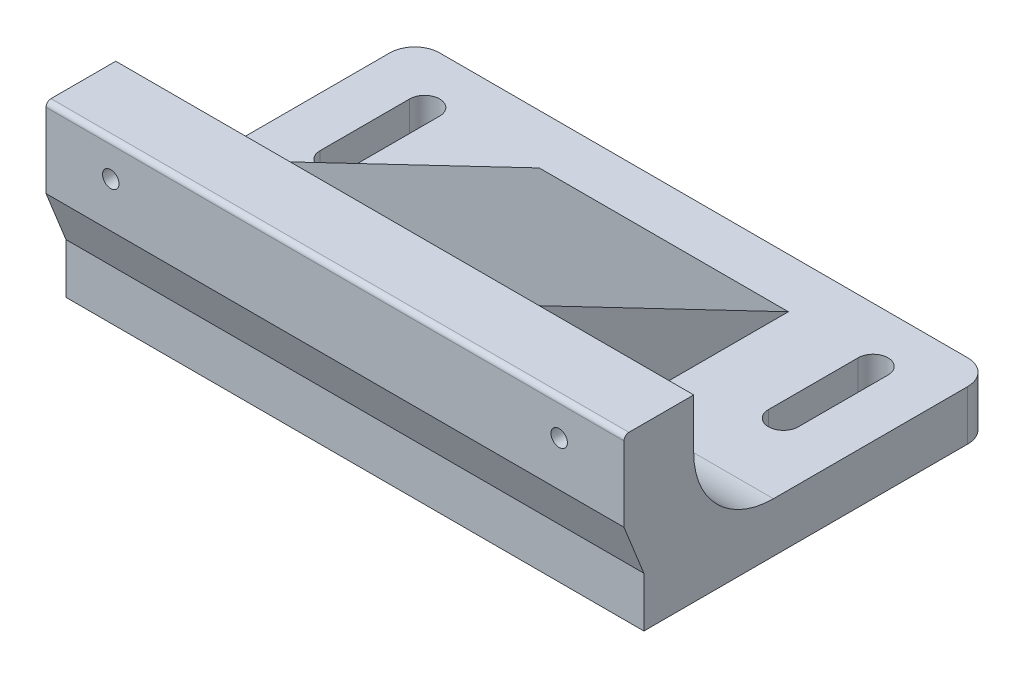
from build123d import *

# Parameters (mm, degrees)
SKETCH1_W           = 116
SKETCH1_H           = 70
BOSS_EXTRUDE1_DEPTH = 10
SKETCH2_W           = 116
SKETCH2_H           = 9.05
BOSS_EXTRUDE2_DEPTH = 10
CUT_EXTRUDE1_DEPTH  = 136.852861582
SKETCH4_W           = 116
SKETCH4_H           = 17
BOSS_EXTRUDE3_DEPTH = 10
FILLET1_R           = 16
BOSS_EXTRUDE4_START = -85
BOSS_EXTRUDE4_DEPTH = 50
SKETCH7_W           = 4
SKETCH7_H           = 16
BOSS_EXTRUDE5_DEPTH = 116
CHAMFER1_SIZE2      = 4
CHAMFER1_SIZE       = 10
FILLET3_R           = 1
FILLET4_R           = 5
SKETCH8_R           = 1.65
CUT_EXTRUDE2_DEPTH  = 143.237837793
SKETCH9_R           = 2.25
CUT_EXTRUDE3_DEPTH  = 5


with BuildPart() as part:
    # Sketch1 → Boss-Extrude1 (new body)
    with BuildSketch(Plane(origin=(0, 0, 0), x_dir=(1, 0, 0), z_dir=(0, 1, 0))):
        with Locations((58, 35)):
            Rectangle(SKETCH1_W, SKETCH1_H)
    extrude(amount=BOSS_EXTRUDE1_DEPTH)

    # Sketch2 → Boss-Extrude2 (add)
    with BuildSketch(Plane.XY):
        with Locations((58, 14.525)):
            Rectangle(SKETCH2_W, SKETCH2_H)
    extrude(amount=-BOSS_EXTRUDE2_DEPTH)

    # Sketch3 → Cut-Extrude1 (cut, through all)
    with BuildSketch(Plane(origin=(0, 10, 0), x_dir=(1, 0, 0), z_dir=(0, 1, 0))):
        with BuildLine():
            Line((16, 59), (16, 41))
            ThreePointArc((16, 41), (13, 38), (10, 41))
            Line((10, 41), (10, 59))
            ThreePointArc((10, 59), (13, 62), (16, 59))
        make_face()
        with BuildLine():
            Line((100, 59), (100, 41))
            ThreePointArc((100, 41), (103, 38), (106, 41))
            Line((106, 41), (106, 59))
            ThreePointArc((106, 59), (103, 62), (100, 59))
        make_face()
    extrude(amount=-CUT_EXTRUDE1_DEPTH, mode=Mode.SUBTRACT)

    # Sketch4 → Boss-Extrude3 (add)
    with BuildSketch(Plane.XY):
        with Locations((58, 27.55)):
            Rectangle(SKETCH4_W, SKETCH4_H)
    extrude(amount=-BOSS_EXTRUDE3_DEPTH)

    # Fillet1
    fillet1_edges = [part.edges().sort_by_distance(p)[0] for p in [
        (58, 10, -10),
    ]]
    fillet(fillet1_edges, radius=FILLET1_R)

    # Sketch6 → Boss-Extrude4 (add)
    with BuildSketch(Plane.ZY.offset(BOSS_EXTRUDE4_START)):
        with BuildLine():
            Line((-10, 36.05), (-60, 10))
            Line((-60, 10), (-26, 10))
            ThreePointArc((-26, 10), (-14.686291501, 14.686291501), (-10, 26))
            Line((-10, 26), (-10, 36.05))
        make_face()
    extrude(amount=BOSS_EXTRUDE4_DEPTH)

    # Sketch7 → Boss-Extrude5 (add)
    with BuildSketch(Plane.ZY):
        with Locations((2, 28.05)):
            Rectangle(SKETCH7_W, SKETCH7_H)
    extrude(amount=-BOSS_EXTRUDE5_DEPTH)

    # Chamfer1
    chamfer1_edges = [part.edges().sort_by_distance(p)[0] for p in [
        (58, 20.05, 0),
    ]]
    chamfer1_side = [part.faces().sort_by_distance(p)[0] for p in [
        (58, 19.97, 0),
    ]]
    chamfer(chamfer1_edges, length=CHAMFER1_SIZE - 0.0001, length2=CHAMFER1_SIZE2 - 0.0001, reference=chamfer1_side[0])  # a hair under: the kernel refuses the full size

    # Fillet3
    fillet3_edges = [part.edges().sort_by_distance(p)[0] for p in [
        (58, 36.05, 4),
    ]]
    fillet(fillet3_edges, radius=FILLET3_R)

    # Fillet4
    fillet4_edges = [part.edges().sort_by_distance(p)[0] for p in [
        (0, 5, -70),
        (116, 5, -70),
    ]]
    fillet(fillet4_edges, radius=FILLET4_R)

    # Sketch8 → Cut-Extrude2 (cut, through all)
    with BuildSketch(Plane.XY.offset(4)):
        with Locations((13, 29.05)):
            Circle(SKETCH8_R)
        with Locations((103, 29.05)):
            Circle(SKETCH8_R)
    extrude(amount=-CUT_EXTRUDE2_DEPTH, mode=Mode.SUBTRACT)

    # Sketch9 → Cut-Extrude3 (cut)
    with BuildSketch(Plane(origin=(0, 0, -10), x_dir=(-1, 0, 0), z_dir=(0, 0, -1))):
        with Locations((-103, 29.05)):
            Circle(SKETCH9_R)
        with Locations((-13, 29.05)):
            Circle(SKETCH9_R)
    extrude(amount=-CUT_EXTRUDE3_DEPTH, mode=Mode.SUBTRACT)


solid = part.part
